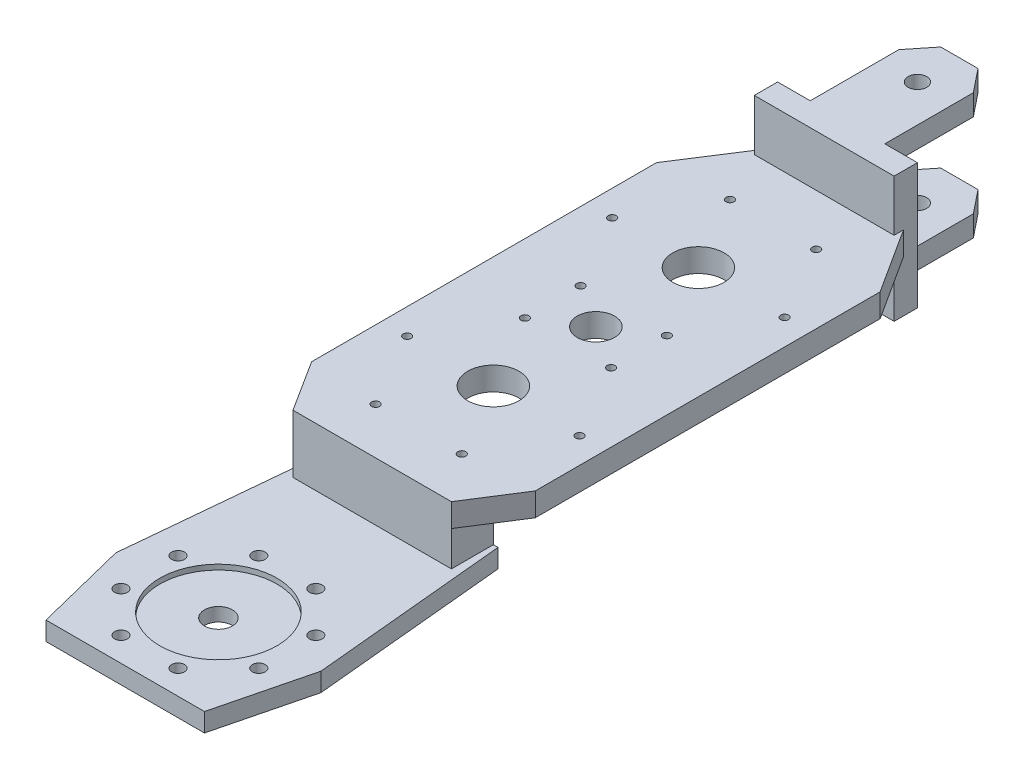
from build123d import *

# Parameters (mm, degrees)
SK_KNEE_PLATE_R         = 2.75
SK_KNEE_PLATE_R_2       = 6
KNEE_PLATE_DEPTH        = 8
SK_KNEE_PILOT_RECESS_R  = 25.15
KNEE_PILOT_RECESS_DEPTH = 2.2
SK_JOGGLE_W             = 68
SK_JOGGLE_H             = 33
JOGGLE_DEPTH            = 18
SK_WEB_R                = 1.7
SK_WEB_R_2              = 11
SK_WEB_R_3              = 8
WEB_DEPTH               = 10
SK_FORK_BAR_W           = 60
SK_FORK_BAR_H           = 54
FORK_BAR_DEPTH          = 10
SK_TINE_LAT_R           = 4
TINE_LAT_DEPTH          = 9
SK_TINE_MED_R           = 4
TINE_MED_DEPTH          = 9


with BuildPart() as part:
    # SK_Knee_Plate → Knee_Plate (new body)
    with BuildSketch(Plane(origin=(0, -28, 0), x_dir=(1, 0, 0), z_dir=(0, 1, 0))):
        Polygon((-34, -40), (34, -40), (44, 0), (36, 84), (-36, 84), (-44, 0), align=None)
        with Locations((29.56414504, 12.245869836)):
            Circle(SK_KNEE_PLATE_R, mode=Mode.SUBTRACT)
        with Locations((12.245869836, 29.56414504)):
            Circle(SK_KNEE_PLATE_R, mode=Mode.SUBTRACT)
        with Locations((-12.245869836, 29.56414504)):
            Circle(SK_KNEE_PLATE_R, mode=Mode.SUBTRACT)
        with Locations((-29.56414504, 12.245869836)):
            Circle(SK_KNEE_PLATE_R, mode=Mode.SUBTRACT)
        with Locations((-29.56414504, -12.245869836)):
            Circle(SK_KNEE_PLATE_R, mode=Mode.SUBTRACT)
        with Locations((-12.245869836, -29.56414504)):
            Circle(SK_KNEE_PLATE_R, mode=Mode.SUBTRACT)
        with Locations((12.245869836, -29.56414504)):
            Circle(SK_KNEE_PLATE_R, mode=Mode.SUBTRACT)
        with Locations((29.56414504, -12.245869836)):
            Circle(SK_KNEE_PLATE_R, mode=Mode.SUBTRACT)
        Circle(SK_KNEE_PLATE_R_2, mode=Mode.SUBTRACT)
    extrude(amount=KNEE_PLATE_DEPTH)

    # SK_Knee_Pilot_Recess → Knee_Pilot_Recess (cut)
    with BuildSketch(Plane(origin=(0, -20, 0), x_dir=(1, 0, 0), z_dir=(0, 1, 0))):
        Circle(SK_KNEE_PILOT_RECESS_R)
    extrude(amount=-KNEE_PILOT_RECESS_DEPTH, mode=Mode.SUBTRACT)

    # SK_Joggle → Joggle (add)
    with BuildSketch(Plane.XY.offset(-84)):
        with Locations((0, -11.5)):
            Rectangle(SK_JOGGLE_W, SK_JOGGLE_H)
    extrude(amount=JOGGLE_DEPTH)

    # SK_Web → Web (add)
    with BuildSketch(Plane(origin=(0, -5, 0), x_dir=(1, 0, 0), z_dir=(0, 1, 0))):
        Polygon((-34, 66), (34, 66), (48, 88), (48, 236), (30, 264), (-30, 264), (-48, 236), (-48, 88), align=None)
        with Locations((37, 118)):
            Circle(SK_WEB_R, mode=Mode.SUBTRACT)
        with Locations((18.5, 150.04293994)):
            Circle(SK_WEB_R, mode=Mode.SUBTRACT)
        with Locations((-18.5, 150.04293994)):
            Circle(SK_WEB_R, mode=Mode.SUBTRACT)
        with Locations((-37, 118)):
            Circle(SK_WEB_R, mode=Mode.SUBTRACT)
        with Locations((-18.5, 85.95706006)):
            Circle(SK_WEB_R, mode=Mode.SUBTRACT)
        with Locations((18.5, 85.95706006)):
            Circle(SK_WEB_R, mode=Mode.SUBTRACT)
        with Locations((37, 206)):
            Circle(SK_WEB_R, mode=Mode.SUBTRACT)
        with Locations((18.5, 238.04293994)):
            Circle(SK_WEB_R, mode=Mode.SUBTRACT)
        with Locations((-18.5, 238.04293994)):
            Circle(SK_WEB_R, mode=Mode.SUBTRACT)
        with Locations((-37, 206)):
            Circle(SK_WEB_R, mode=Mode.SUBTRACT)
        with Locations((-18.5, 173.95706006)):
            Circle(SK_WEB_R, mode=Mode.SUBTRACT)
        with Locations((18.5, 173.95706006)):
            Circle(SK_WEB_R, mode=Mode.SUBTRACT)
        with Locations((0, 118)):
            Circle(SK_WEB_R_2, mode=Mode.SUBTRACT)
        with Locations((0, 206)):
            Circle(SK_WEB_R_2, mode=Mode.SUBTRACT)
        with Locations((0, 162)):
            Circle(SK_WEB_R_3, mode=Mode.SUBTRACT)
    extrude(amount=WEB_DEPTH)

    # SK_Fork_Bar → Fork_Bar (add)
    with BuildSketch(Plane.XY.offset(-270)):
        Rectangle(SK_FORK_BAR_W, SK_FORK_BAR_H)
    extrude(amount=FORK_BAR_DEPTH)

    # SK_Tine_Lat → Tine_Lat (add)
    with BuildSketch(Plane(origin=(0, 18, 0), x_dir=(1, 0, 0), z_dir=(0, 1, 0))):
        Polygon((-16, 260), (16, 260), (16, 308), (8, 318), (-8, 318), (-16, 308), align=None)
        with Locations((0, 300)):
            Circle(SK_TINE_LAT_R, mode=Mode.SUBTRACT)
    extrude(amount=TINE_LAT_DEPTH)

    # SK_Tine_Med → Tine_Med (add)
    with BuildSketch(Plane(origin=(0, -27, 0), x_dir=(1, 0, 0), z_dir=(0, 1, 0))):
        Polygon((-16, 260), (16, 260), (16, 308), (8, 318), (-8, 318), (-16, 308), align=None)
        with Locations((0, 300)):
            Circle(SK_TINE_MED_R, mode=Mode.SUBTRACT)
    extrude(amount=TINE_MED_DEPTH)


solid = part.part
